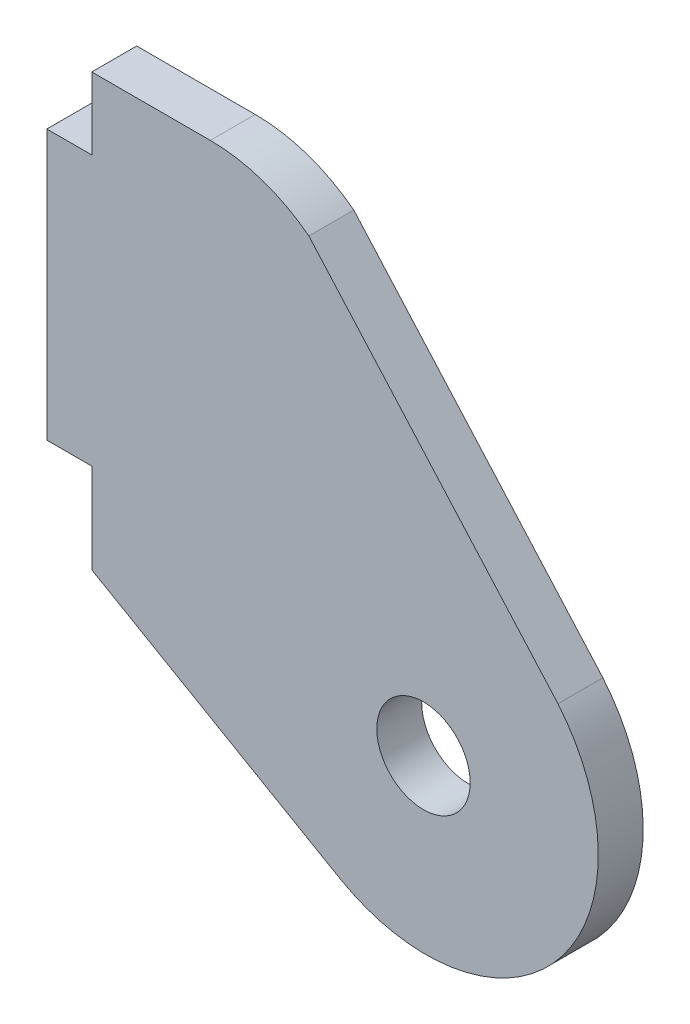
from build123d import *

# Parameters (mm, degrees)
BOSS_EXTRUDE1_DEPTH      = 3.175
M6_CLEARANCE_HOLE1_D     = 6.6
M6_CLEARANCE_HOLE1_DEPTH = 3.302
M6_CLEARANCE_HOLE1_TIP   = 1.982840043


with BuildPart() as part:
    # Sketch1 → Boss-Extrude1 (new body)
    with BuildSketch(Plane.XY):
        with BuildLine():
            Line((-79.409543338, -48.870574021), (-79.409543338, -29.820574021))
            Line((-79.409543338, -29.820574021), (-76.234543338, -29.820574021))
            Line((-76.234543338, -29.820574021), (-76.234543338, -24.740574021))
            Line((-76.234543338, -24.740574021), (-67.852543338, -24.740574021))
            ThreePointArc((-67.852543338, -24.740574021), (-64.175656813, -25.348124877), (-60.889653149, -27.10618986))
            Line((-60.889653149, -27.10618986), (-43.281292183, -46.938938374))
            ThreePointArc((-43.281292183, -46.938938374), (-43.281292183, -62.612671449), (-58.716906034, -65.334386634))
            Line((-58.716906034, -65.334386634), (-76.234543338, -55.220574021))
            Line((-76.234543338, -55.220574021), (-76.234543338, -48.870574021))
            Line((-76.234543338, -48.870574021), (-79.409543338, -48.870574021))
        make_face()
    extrude(amount=BOSS_EXTRUDE1_DEPTH)

    # M6 Clearance Hole1
    with Locations(Plane(origin=(0, 0, 0), x_dir=(-1, 0, 0), z_dir=(0, 0, -1))):
        with Locations((52.785761686, -54.878805276)):
            Hole(M6_CLEARANCE_HOLE1_D / 2, depth=M6_CLEARANCE_HOLE1_DEPTH)
            with Locations((0, 0, -(M6_CLEARANCE_HOLE1_DEPTH + M6_CLEARANCE_HOLE1_TIP / 2))):  # 118° drill point
                Cone(0, M6_CLEARANCE_HOLE1_D / 2, M6_CLEARANCE_HOLE1_TIP, mode=Mode.SUBTRACT)


solid = part.part
